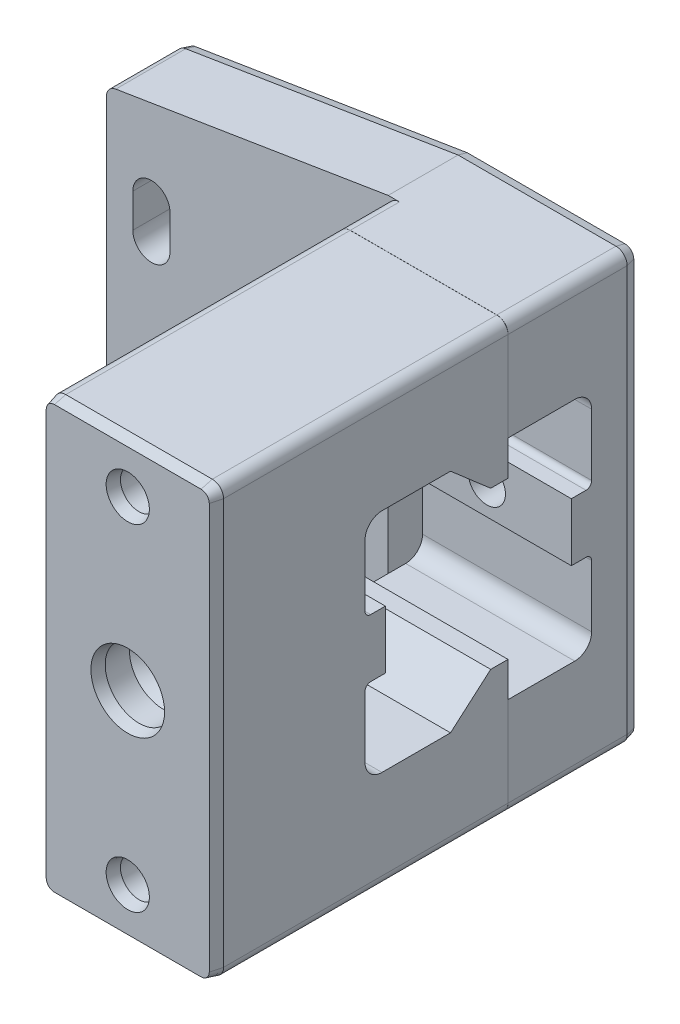
from build123d import *
from OCP.BRepFilletAPI import BRepFilletAPI_MakeChamfer

# Parameters (mm, degrees)
SKETCH1_R       = 1.65
SKETCH1_W       = 25
SKETCH1_H       = 29.9
EXTRUDE1_DEPTH  = 4
EXTRUDE2_DEPTH  = 4
FILLET1_R       = 1
SKETCH_R        = 1.65
EXTRUDE3_DEPTH  = 37.6
EXTRUDE4_REACH  = 51.146
EXTRUDE5_REACH  = 49.347
SKETCH4_R       = 1.65
FILLET2_R       = 1
EXTRUDE6_START  = -15
SKETCH5_W       = 0.01
SKETCH5_H       = 44.520085812
EXTRUDE6_DEPTH  = 15
EXTRUDE7_DEPTH  = 15
SKETCH7_W       = 15
SKETCH7_H       = 5.15
SKETCH7_R       = 1.65
EXTRUDE8_DEPTH  = 1.8
SKETCH_2_R      = 1.65
EXTRUDE9_DEPTH  = 48.347330088
SKETCH8_W       = 15
SKETCH8_H       = 5.15
SKETCH8_R       = 1.65
EXTRUDE10_DEPTH = 1.8
SKETCH11_R      = 3
EXTRUDE15_DEPTH = 3
CHAMFER1_SIZE   = 1.5
FILLET7_R       = 0.5
FILLET8_R       = 0.5
CHAMFER4_SIZE   = 1
CHAMFER4_SIZE2  = 0.267949192
EXTRUDE14_DEPTH = 10.5
CHAMFER5_SIZE   = 0.8
CHAMFER5_SIZE2  = 0.214359354
CHAMFER6_SIZE   = 0.8
CHAMFER6_SIZE2  = 0.214359354
EXTRUDE16_DEPTH = 5
CHAMFER7_SIZE   = 0.8
CHAMFER7_SIZE2  = 0.214359354
EXTRUDE17_DEPTH = 3


# Read off the part's stored shape, not the designer's step: Extrude17
with BuildPart() as part:
    # Sketch1 → Extrude1 (new body)
    # profile 1 of 2: a face of its own
    with BuildSketch(Plane.XY):
        Polygon((6.246843528, 15.35570294), (6.246843528, -14.54429706), (6.246843528, -18.59429706), (21.246843528, -18.59429706), (21.246843528, 19.40570294), (6.246843528, 19.40570294), align=None)
        with Locations((13.746843528, -14.49429706)):
            Circle(SKETCH1_R, mode=Mode.SUBTRACT)
        with Locations((13.746843528, 15.30570294)):
            Circle(SKETCH1_R, mode=Mode.SUBTRACT)
    # profile 2 of 2: a face of its own
    with BuildSketch(Plane.XY):
        with Locations((-6.253156472, 0.40570294)):
            Rectangle(SKETCH1_W, SKETCH1_H)
        with BuildLine():
            ThreePointArc((-13.103156472, -7.59429706), (-14.753156472, -9.24429706), (-16.403156472, -7.59429706))
            Line((-16.403156472, -7.59429706), (-16.403156472, -4.59429706))
            ThreePointArc((-16.403156472, -4.59429706), (-14.753156472, -2.94429706), (-13.103156472, -4.59429706))
            Line((-13.103156472, -4.59429706), (-13.103156472, -7.59429706))
        make_face(mode=Mode.SUBTRACT)
        with BuildLine():
            ThreePointArc((1.896843528, -7.59429706), (0.246843528, -9.24429706), (-1.403156472, -7.59429706))
            Line((-1.403156472, -7.59429706), (-1.403156472, -4.59429706))
            ThreePointArc((-1.403156472, -4.59429706), (0.246843528, -2.94429706), (1.896843528, -4.59429706))
            Line((1.896843528, -4.59429706), (1.896843528, -7.59429706))
        make_face(mode=Mode.SUBTRACT)
        with BuildLine():
            ThreePointArc((-16.403156472, 8.40570294), (-14.753156472, 10.05570294), (-13.103156472, 8.40570294))
            Line((-13.103156472, 8.40570294), (-13.103156472, 5.40570294))
            ThreePointArc((-13.103156472, 5.40570294), (-14.753156472, 3.75570294), (-16.403156472, 5.40570294))
            Line((-16.403156472, 5.40570294), (-16.403156472, 8.40570294))
        make_face(mode=Mode.SUBTRACT)
        with BuildLine():
            ThreePointArc((-1.403156472, 8.40570294), (0.246843528, 10.05570294), (1.896843528, 8.40570294))
            Line((1.896843528, 8.40570294), (1.896843528, 5.40570294))
            ThreePointArc((1.896843528, 5.40570294), (0.246843528, 3.75570294), (-1.403156472, 5.40570294))
            Line((-1.403156472, 5.40570294), (-1.403156472, 8.40570294))
        make_face(mode=Mode.SUBTRACT)
    extrude(amount=EXTRUDE1_DEPTH)

    # Sketch2 → Extrude2 (add)
    with BuildSketch(Plane(origin=(0, 0, 0), x_dir=(-1, 0, 0), z_dir=(0, 0, -1))):
        Polygon((-6.246843528, 19.40570294), (18.753156472, 15.35570294), (-6.246843528, 15.35570294), align=None)
        Polygon((-6.246843528, -14.54429706), (-6.246843528, -18.59429706), (18.753156472, -14.54429706), align=None)
    extrude(amount=-EXTRUDE2_DEPTH)

    # Fillet1
    fillet1_edges = [part.edges().sort_by_distance(p)[0] for p in [
        (-18.753156472, -14.54429706, 2),
        (-18.753156472, 15.35570294, 2),
    ]]
    fillet(fillet1_edges, radius=FILLET1_R)

    # Sketch → Extrude3 (add)
    with BuildSketch(Plane.XY):
        Polygon((21.246843528, 19.40570294), (6.246843528, 19.40570294), (6.246843528, 15.35570294), (6.246843528, -14.54429706), (6.246843528, -18.59429706), (21.246843528, -18.59429706), align=None)
        with Locations((13.746843528, -14.49429706)):
            Circle(SKETCH_R, mode=Mode.SUBTRACT)
        with Locations((13.746843528, 15.30570294)):
            Circle(SKETCH_R, mode=Mode.SUBTRACT)
    extrude(amount=EXTRUDE3_DEPTH)

    # Sketch3 → Extrude4 (cut, up to next)
    with BuildSketch(Plane.ZY.offset(-6.246843528), mode=Mode.PRIVATE) as extrude4_sk1:
        with BuildLine():
            Line((22.55, -9.64429706), (5.45, -9.64429706))
            ThreePointArc((5.45, -9.64429706), (4.389339828, -9.204957232), (3.95, -8.14429706))
            Line((3.95, -8.14429706), (3.95, 8.95570294))
            ThreePointArc((3.95, 8.95570294), (4.389339828, 10.016363112), (5.45, 10.45570294))
            Line((5.45, 10.45570294), (22.55, 10.45570294))
            ThreePointArc((22.55, 10.45570294), (23.610660172, 10.016363112), (24.05, 8.95570294))
            Line((24.05, 8.95570294), (24.05, -8.14429706))
            ThreePointArc((24.05, -8.14429706), (23.610660172, -9.204957232), (22.55, -9.64429706))
        make_face()
    extrude4_tool1 = extrude(extrude4_sk1.sketch, amount=-EXTRUDE4_REACH, mode=Mode.PRIVATE) & part.part
    add(extrude4_tool1.solids().sort_by_distance((6.246844, 0.405703, 14))[0], mode=Mode.SUBTRACT)

    # Sketch4 → Extrude5 (cut, up to next)
    with BuildSketch(Plane(origin=(0, 0, 0), x_dir=(-1, 0, 0), z_dir=(0, 0, -1)), mode=Mode.PRIVATE) as extrude5_sk1:
        with Locations((-13.746843528, 0.40570294)):
            Circle(SKETCH4_R)
    extrude5_tool1 = extrude(extrude5_sk1.sketch, amount=-EXTRUDE5_REACH, mode=Mode.PRIVATE) & part.part
    add(extrude5_tool1.solids().sort_by_distance((13.746844, 0.405703, 0))[0], mode=Mode.SUBTRACT)

    # Fillet2
    fillet2_edges = [part.edges().sort_by_distance(p)[0] for p in [
        (6.246843528, 19.40570294, 20.8),
        (6.246843528, -18.59429706, 20.8),
        (21.246843528, 19.40570294, 18.8),
        (21.246843528, -18.59429706, 18.8),
    ]]
    fillet(fillet2_edges, radius=FILLET2_R)

    # Sketch5 → Extrude6 (cut)
    with BuildSketch(Plane(origin=(21.246843528, 0, 0), x_dir=(0, 0, -1), z_dir=(1, 0, 0)).offset(EXTRUDE6_START)):
        with Locations((-11.365, -0.632215512)):
            Rectangle(SKETCH5_W, SKETCH5_H)
    extrude(amount=EXTRUDE6_DEPTH, mode=Mode.SUBTRACT)


with BuildPart() as extrude6_piece_1:
    # of the separate pieces the step leaves, piece 1, a body of its own (extrude6_pieces)
    add(part.part.solids().sort_by_distance((7.246843528, -18.59429706, 11.37))[0])

    # Sketch6 → Extrude7 (add)
    with BuildSketch(Plane(origin=(21.246843528, 0, 0), x_dir=(0, 0, -1), z_dir=(1, 0, 0))):
        Polygon((-11.37, 10.45570294), (-11.37, 7.362293772), (-12.906590833, 7.362293772), (-16.47, 10.45570294), align=None)
        Polygon((-16.47, -9.64429706), (-11.37, -9.64429706), (-11.37, -6.550887893), (-12.906590833, -6.550887893), align=None)
    extrude(amount=-EXTRUDE7_DEPTH)

    # Sketch 2 → Extrude9 (cut, through all)
    with BuildSketch(Plane(origin=(0, 0, 0), x_dir=(-1, 0, 0), z_dir=(0, 0, -1))):
        with Locations((-13.746843528, 0.40570294)):
            Circle(SKETCH_2_R)
    extrude(amount=-EXTRUDE9_DEPTH, mode=Mode.SUBTRACT)

    # Sketch8 → Extrude10 (add)
    with BuildSketch(Plane(origin=(0, 0, 24.05), x_dir=(-1, 0, 0), z_dir=(0, 0, -1))):
        with Locations((-13.746843528, 0.40570294)):
            Rectangle(SKETCH8_W, SKETCH8_H)
        with Locations((-13.746843528, 0.40570294)):
            Circle(SKETCH8_R, mode=Mode.SUBTRACT)
    extrude(amount=EXTRUDE10_DEPTH)

    # Sketch11 → Extrude15 (cut)
    with BuildSketch(Plane.XY.offset(37.6)):
        with Locations((13.746843528, 0.40570294)):
            Circle(SKETCH11_R)
    extrude(amount=-EXTRUDE15_DEPTH, mode=Mode.SUBTRACT)

    # Chamfer1
    # the kernel refuses this chamfer: 1.5 mm, written as the material it takes off along each edge
    with BuildSketch(Plane(origin=(13.746843528, 0.40570294, 34.6), x_dir=(-1, 0, 0), z_dir=(0, -1, 0))) as chamfer1_piece_1_section:
        Polygon((1.65 + CHAMFER1_SIZE, 0), (1.65, CHAMFER1_SIZE), (1.65, 0), align=None)
    chamfer1_piece_1 = revolve(axis=Axis((13.746843528, 0.40570294, 34.6), (0, 0, -1)), mode=Mode.PRIVATE)
    chamfer1_piece_1 = chamfer1_piece_1 & Plane(origin=(13.746843528, 0.40570294, 33.771694066), x_dir=(1, 0, 0), z_dir=(0, 0, 1)) * Cylinder(3, 13, mode=Mode.PRIVATE)
    add(chamfer1_piece_1, mode=Mode.SUBTRACT)

    # Fillet7
    fillet7_edges = [extrude6_piece_1.edges().sort_by_distance(p)[0] for p in [
        (13.746843528, 2.98070294, 24.05),
        (13.746843528, -2.16929706, 24.05),
    ]]
    fillet(fillet7_edges, radius=FILLET7_R)

    # Chamfer4: one chamfer whose edges measure the first distance from different faces: ONE call of the kernel's chamfer builder (chamfer() names one face for all edges)
    chamfer4_edges_1 = [extrude6_piece_1.edges().sort_by_distance(p)[0] for p in [
        (12.096843528, 15.30570294, 37.6),
    ]]
    chamfer4_side_1 = [extrude6_piece_1.faces().sort_by_distance(p)[0] for p in [
        (12.096843528, 15.30570294, 24.485),
    ]]
    chamfer4_edges_2 = [extrude6_piece_1.edges().sort_by_distance(p)[0] for p in [
        (12.096843528, -14.49429706, 37.6),
    ]]
    chamfer4_side_2 = [extrude6_piece_1.faces().sort_by_distance(p)[0] for p in [
        (12.096843528, -14.49429706, 24.485),
    ]]
    chamfer4_edges_3 = [extrude6_piece_1.edges().sort_by_distance(p)[0] for p in [
        (13.746843528, -18.59429706, 37.6),
    ]]
    chamfer4_side_3 = [extrude6_piece_1.faces().sort_by_distance(p)[0] for p in [
        (13.746843528, -18.59429706, 24.485),
    ]]
    chamfer4_edges_4 = [extrude6_piece_1.edges().sort_by_distance(p)[0] for p in [
        (6.246843528, 0.40570294, 37.6),
    ]]
    chamfer4_side_4 = [extrude6_piece_1.faces().sort_by_distance(p)[0] for p in [
        (6.246843528, 0.40570294, 26.542021551),
    ]]
    chamfer4_edges_5 = [extrude6_piece_1.edges().sort_by_distance(p)[0] for p in [
        (13.746843528, 19.40570294, 37.6),
    ]]
    chamfer4_side_5 = [extrude6_piece_1.faces().sort_by_distance(p)[0] for p in [
        (13.746843528, 19.40570294, 24.485),
    ]]
    chamfer4_edges_6 = [extrude6_piece_1.edges().sort_by_distance(p)[0] for p in [
        (21.246843528, 0.40570294, 37.6),
    ]]
    chamfer4_side_6 = [extrude6_piece_1.faces().sort_by_distance(p)[0] for p in [
        (21.246843528, 0.40570294, 26.542021551),
    ]]
    chamfer4_edges_7 = [extrude6_piece_1.edges().sort_by_distance(p)[0] for p in [
        (20.953950309, 19.112809721, 37.6),
    ]]
    chamfer4_side_7 = [extrude6_piece_1.faces().sort_by_distance(p)[0] for p in [
        (20.953950309, 19.112809721, 24.485),
    ]]
    chamfer4_edges_8 = [extrude6_piece_1.edges().sort_by_distance(p)[0] for p in [
        (20.953950309, -18.301403841, 37.6),
    ]]
    chamfer4_side_8 = [extrude6_piece_1.faces().sort_by_distance(p)[0] for p in [
        (20.953950309, -18.301403841, 24.485),
    ]]
    chamfer4_edges_9 = [extrude6_piece_1.edges().sort_by_distance(p)[0] for p in [
        (6.539736747, 19.112809721, 37.6),
    ]]
    chamfer4_side_9 = [extrude6_piece_1.faces().sort_by_distance(p)[0] for p in [
        (6.539736747, 19.112809721, 24.485),
    ]]
    chamfer4_edges_10 = [extrude6_piece_1.edges().sort_by_distance(p)[0] for p in [
        (6.539736747, -18.301403841, 37.6),
    ]]
    chamfer4_side_10 = [extrude6_piece_1.faces().sort_by_distance(p)[0] for p in [
        (6.539736747, -18.301403841, 24.485),
    ]]
    chamfer4_edges_11 = [extrude6_piece_1.edges().sort_by_distance(p)[0] for p in [
        (10.746843528, 0.40570294, 37.6),
    ]]
    chamfer4_side_11 = [extrude6_piece_1.faces().sort_by_distance(p)[0] for p in [
        (10.746843528, 0.40570294, 36.025),
    ]]
    chamfer4 = BRepFilletAPI_MakeChamfer(extrude6_piece_1.part.solid().wrapped)
    for e in chamfer4_edges_1:
        chamfer4.Add(CHAMFER4_SIZE, CHAMFER4_SIZE2, e.wrapped, chamfer4_side_1[0].wrapped)  # the first distance lies on this face
    for e in chamfer4_edges_2:
        chamfer4.Add(CHAMFER4_SIZE, CHAMFER4_SIZE2, e.wrapped, chamfer4_side_2[0].wrapped)  # the first distance lies on this face
    for e in chamfer4_edges_3:
        chamfer4.Add(CHAMFER4_SIZE, CHAMFER4_SIZE2, e.wrapped, chamfer4_side_3[0].wrapped)  # the first distance lies on this face
    for e in chamfer4_edges_4:
        chamfer4.Add(CHAMFER4_SIZE, CHAMFER4_SIZE2, e.wrapped, chamfer4_side_4[0].wrapped)  # the first distance lies on this face
    for e in chamfer4_edges_5:
        chamfer4.Add(CHAMFER4_SIZE, CHAMFER4_SIZE2, e.wrapped, chamfer4_side_5[0].wrapped)  # the first distance lies on this face
    for e in chamfer4_edges_6:
        chamfer4.Add(CHAMFER4_SIZE, CHAMFER4_SIZE2, e.wrapped, chamfer4_side_6[0].wrapped)  # the first distance lies on this face
    for e in chamfer4_edges_7:
        chamfer4.Add(CHAMFER4_SIZE, CHAMFER4_SIZE2, e.wrapped, chamfer4_side_7[0].wrapped)  # the first distance lies on this face
    for e in chamfer4_edges_8:
        chamfer4.Add(CHAMFER4_SIZE, CHAMFER4_SIZE2, e.wrapped, chamfer4_side_8[0].wrapped)  # the first distance lies on this face
    for e in chamfer4_edges_9:
        chamfer4.Add(CHAMFER4_SIZE, CHAMFER4_SIZE2, e.wrapped, chamfer4_side_9[0].wrapped)  # the first distance lies on this face
    for e in chamfer4_edges_10:
        chamfer4.Add(CHAMFER4_SIZE, CHAMFER4_SIZE2, e.wrapped, chamfer4_side_10[0].wrapped)  # the first distance lies on this face
    for e in chamfer4_edges_11:
        chamfer4.Add(CHAMFER4_SIZE, CHAMFER4_SIZE2, e.wrapped, chamfer4_side_11[0].wrapped)  # the first distance lies on this face
    add(Compound.cast(chamfer4.Shape()), mode=Mode.REPLACE)

    # Sketch10 → Extrude14 (cut)
    with BuildSketch(Plane(origin=(0, 0, 11.37), x_dir=(-1, 0, 0), z_dir=(0, 0, -1))):
        Polygon((-10.917827209, 15.30570294), (-12.332335368, 17.75570294), (-15.161351687, 17.75570294), (-16.575859847, 15.30570294), (-15.161351687, 12.85570294), (-12.332335368, 12.85570294), align=None)
        Polygon((-10.917827209, -14.49429706), (-12.332335368, -12.04429706), (-15.161351687, -12.04429706), (-16.575859847, -14.49429706), (-15.161351687, -16.94429706), (-12.332335368, -16.94429706), align=None)
    extrude(amount=-EXTRUDE14_DEPTH, mode=Mode.SUBTRACT)

    # Chamfer5: one chamfer whose edges measure the first distance from different faces: ONE call of the kernel's chamfer builder (chamfer() names one face for all edges)
    chamfer5_edges_1 = [extrude6_piece_1.edges().sort_by_distance(p)[0] for p in [
        (11.625081289, 14.08070294, 11.37),
    ]]
    chamfer5_side_1 = [extrude6_piece_1.faces().sort_by_distance(p)[0] for p in [
        (11.625081289, 14.08070294, 16.62),
    ]]
    chamfer5_edges_2 = [extrude6_piece_1.edges().sort_by_distance(p)[0] for p in [
        (11.625081289, 16.53070294, 11.37),
    ]]
    chamfer5_side_2 = [extrude6_piece_1.faces().sort_by_distance(p)[0] for p in [
        (11.625081289, 16.53070294, 16.62),
    ]]
    chamfer5_edges_3 = [extrude6_piece_1.edges().sort_by_distance(p)[0] for p in [
        (13.746843528, 17.75570294, 11.37),
    ]]
    chamfer5_side_3 = [extrude6_piece_1.faces().sort_by_distance(p)[0] for p in [
        (13.746843528, 17.75570294, 16.62),
    ]]
    chamfer5_edges_4 = [extrude6_piece_1.edges().sort_by_distance(p)[0] for p in [
        (15.868605767, 16.53070294, 11.37),
    ]]
    chamfer5_side_4 = [extrude6_piece_1.faces().sort_by_distance(p)[0] for p in [
        (15.868605767, 16.53070294, 16.62),
    ]]
    chamfer5_edges_5 = [extrude6_piece_1.edges().sort_by_distance(p)[0] for p in [
        (15.868605767, 14.08070294, 11.37),
    ]]
    chamfer5_side_5 = [extrude6_piece_1.faces().sort_by_distance(p)[0] for p in [
        (15.868605767, 14.08070294, 16.62),
    ]]
    chamfer5_edges_6 = [extrude6_piece_1.edges().sort_by_distance(p)[0] for p in [
        (13.746843528, 12.85570294, 11.37),
    ]]
    chamfer5_side_6 = [extrude6_piece_1.faces().sort_by_distance(p)[0] for p in [
        (13.746843528, 12.85570294, 16.62),
    ]]
    chamfer5_edges_7 = [extrude6_piece_1.edges().sort_by_distance(p)[0] for p in [
        (11.625081289, -15.71929706, 11.37),
    ]]
    chamfer5_side_7 = [extrude6_piece_1.faces().sort_by_distance(p)[0] for p in [
        (11.625081289, -15.71929706, 16.62),
    ]]
    chamfer5_edges_8 = [extrude6_piece_1.edges().sort_by_distance(p)[0] for p in [
        (11.625081289, -13.26929706, 11.37),
    ]]
    chamfer5_side_8 = [extrude6_piece_1.faces().sort_by_distance(p)[0] for p in [
        (11.625081289, -13.26929706, 16.62),
    ]]
    chamfer5_edges_9 = [extrude6_piece_1.edges().sort_by_distance(p)[0] for p in [
        (13.746843528, -12.04429706, 11.37),
    ]]
    chamfer5_side_9 = [extrude6_piece_1.faces().sort_by_distance(p)[0] for p in [
        (13.746843528, -12.04429706, 16.62),
    ]]
    chamfer5_edges_10 = [extrude6_piece_1.edges().sort_by_distance(p)[0] for p in [
        (15.868605767, -13.26929706, 11.37),
    ]]
    chamfer5_side_10 = [extrude6_piece_1.faces().sort_by_distance(p)[0] for p in [
        (15.868605767, -13.26929706, 16.62),
    ]]
    chamfer5_edges_11 = [extrude6_piece_1.edges().sort_by_distance(p)[0] for p in [
        (15.868605767, -15.71929706, 11.37),
    ]]
    chamfer5_side_11 = [extrude6_piece_1.faces().sort_by_distance(p)[0] for p in [
        (15.868605767, -15.71929706, 16.62),
    ]]
    chamfer5_edges_12 = [extrude6_piece_1.edges().sort_by_distance(p)[0] for p in [
        (13.746843528, -16.94429706, 11.37),
    ]]
    chamfer5_side_12 = [extrude6_piece_1.faces().sort_by_distance(p)[0] for p in [
        (13.746843528, -16.94429706, 16.62),
    ]]
    chamfer5 = BRepFilletAPI_MakeChamfer(extrude6_piece_1.part.solid().wrapped)
    for e in chamfer5_edges_1:
        chamfer5.Add(CHAMFER5_SIZE, CHAMFER5_SIZE2, e.wrapped, chamfer5_side_1[0].wrapped)  # the first distance lies on this face
    for e in chamfer5_edges_2:
        chamfer5.Add(CHAMFER5_SIZE, CHAMFER5_SIZE2, e.wrapped, chamfer5_side_2[0].wrapped)  # the first distance lies on this face
    for e in chamfer5_edges_3:
        chamfer5.Add(CHAMFER5_SIZE, CHAMFER5_SIZE2, e.wrapped, chamfer5_side_3[0].wrapped)  # the first distance lies on this face
    for e in chamfer5_edges_4:
        chamfer5.Add(CHAMFER5_SIZE, CHAMFER5_SIZE2, e.wrapped, chamfer5_side_4[0].wrapped)  # the first distance lies on this face
    for e in chamfer5_edges_5:
        chamfer5.Add(CHAMFER5_SIZE, CHAMFER5_SIZE2, e.wrapped, chamfer5_side_5[0].wrapped)  # the first distance lies on this face
    for e in chamfer5_edges_6:
        chamfer5.Add(CHAMFER5_SIZE, CHAMFER5_SIZE2, e.wrapped, chamfer5_side_6[0].wrapped)  # the first distance lies on this face
    for e in chamfer5_edges_7:
        chamfer5.Add(CHAMFER5_SIZE, CHAMFER5_SIZE2, e.wrapped, chamfer5_side_7[0].wrapped)  # the first distance lies on this face
    for e in chamfer5_edges_8:
        chamfer5.Add(CHAMFER5_SIZE, CHAMFER5_SIZE2, e.wrapped, chamfer5_side_8[0].wrapped)  # the first distance lies on this face
    for e in chamfer5_edges_9:
        chamfer5.Add(CHAMFER5_SIZE, CHAMFER5_SIZE2, e.wrapped, chamfer5_side_9[0].wrapped)  # the first distance lies on this face
    for e in chamfer5_edges_10:
        chamfer5.Add(CHAMFER5_SIZE, CHAMFER5_SIZE2, e.wrapped, chamfer5_side_10[0].wrapped)  # the first distance lies on this face
    for e in chamfer5_edges_11:
        chamfer5.Add(CHAMFER5_SIZE, CHAMFER5_SIZE2, e.wrapped, chamfer5_side_11[0].wrapped)  # the first distance lies on this face
    for e in chamfer5_edges_12:
        chamfer5.Add(CHAMFER5_SIZE, CHAMFER5_SIZE2, e.wrapped, chamfer5_side_12[0].wrapped)  # the first distance lies on this face
    add(Compound.cast(chamfer5.Shape()), mode=Mode.REPLACE)


with BuildPart() as extrude6_piece_2:
    # of the separate pieces the step leaves, piece 2, a body of its own (extrude6_pieces)
    add(part.part.solids().sort_by_distance((20.246843528, -18.59429706, 0))[0])

    # Sketch7 → Extrude8 (add)
    with BuildSketch(Plane.XY.offset(3.95)):
        with Locations((13.746843528, 0.40570294)):
            Rectangle(SKETCH7_W, SKETCH7_H)
        with Locations(Location((13.746843528, 0.40570294, 0), (0, 0, 180))):
            Circle(SKETCH7_R, mode=Mode.SUBTRACT)
    extrude(amount=EXTRUDE8_DEPTH)

    # Fillet8
    # the kernel refuses this fillet: 0.5 mm, written as the material it adds along each edge
    with BuildSketch(Plane(origin=(6.246843528, -2.16929706, 3.95), x_dir=(0, -1, 0), z_dir=(1, 0, 0)), Plane(origin=(21.246843528, 2.98070294, 3.95), x_dir=(0, 1, 0), z_dir=(-1, 0, 0))) as fillet8_piece_1:
        with BuildLine():
            CenterArc((FILLET8_R, -FILLET8_R), FILLET8_R, 90, 90)
            Line((0, -FILLET8_R), (0, 0))
            Line((0, 0), (FILLET8_R, 0))
        make_face()
    extrude(amount=15)

    # Chamfer6: one chamfer whose edges measure the first distance from different faces: ONE call of the kernel's chamfer builder (chamfer() names one face for all edges)
    chamfer6_edges_1 = [extrude6_piece_2.edges().sort_by_distance(p)[0] for p in [
        (13.246843528, 19.40570294, 0),
    ]]
    chamfer6_side_1 = [extrude6_piece_2.faces().sort_by_distance(p)[0] for p in [
        (13.562244372, 19.40570294, 5.582953586),
    ]]
    chamfer6_edges_2 = [extrude6_piece_2.edges().sort_by_distance(p)[0] for p in [
        (15.396843528, 0.40570294, 0),
    ]]
    chamfer6_side_2 = [extrude6_piece_2.faces().sort_by_distance(p)[0] for p in [
        (15.396843528, 0.40570294, 2.875),
    ]]
    chamfer6_edges_3 = [extrude6_piece_2.edges().sort_by_distance(p)[0] for p in [
        (13.246843528, -18.59429706, 0),
    ]]
    chamfer6_side_3 = [extrude6_piece_2.faces().sort_by_distance(p)[0] for p in [
        (13.562244372, -18.59429706, 5.582953586),
    ]]
    chamfer6_edges_4 = [extrude6_piece_2.edges().sort_by_distance(p)[0] for p in [
        (-16.403156472, -6.09429706, 0),
    ]]
    chamfer6_side_4 = [extrude6_piece_2.faces().sort_by_distance(p)[0] for p in [
        (-16.403156472, -6.09429706, 2),
    ]]
    chamfer6_edges_5 = [extrude6_piece_2.edges().sort_by_distance(p)[0] for p in [
        (1.896843528, 6.90570294, 0),
    ]]
    chamfer6_side_5 = [extrude6_piece_2.faces().sort_by_distance(p)[0] for p in [
        (1.896843528, 6.90570294, 2),
    ]]
    chamfer6_edges_6 = [extrude6_piece_2.edges().sort_by_distance(p)[0] for p in [
        (-1.403156472, -6.09429706, 0),
    ]]
    chamfer6_side_6 = [extrude6_piece_2.faces().sort_by_distance(p)[0] for p in [
        (-1.403156472, -6.09429706, 2),
    ]]
    chamfer6_edges_7 = [extrude6_piece_2.edges().sort_by_distance(p)[0] for p in [
        (21.246843528, 0.40570294, 0),
    ]]
    chamfer6_side_7 = [extrude6_piece_2.faces().sort_by_distance(p)[0] for p in [
        (21.246843528, 0.40570294, 4.557899541),
    ]]
    chamfer6_edges_8 = [extrude6_piece_2.edges().sort_by_distance(p)[0] for p in [
        (-13.103156472, 6.90570294, 0),
    ]]
    chamfer6_side_8 = [extrude6_piece_2.faces().sort_by_distance(p)[0] for p in [
        (-13.103156472, 6.90570294, 2),
    ]]
    chamfer6_edges_9 = [extrude6_piece_2.edges().sort_by_distance(p)[0] for p in [
        (12.096843528, -14.49429706, 0),
    ]]
    chamfer6_side_9 = [extrude6_piece_2.faces().sort_by_distance(p)[0] for p in [
        (12.096843528, -14.49429706, 5.68),
    ]]
    chamfer6_edges_10 = [extrude6_piece_2.edges().sort_by_distance(p)[0] for p in [
        (12.096843528, 15.30570294, 0),
    ]]
    chamfer6_side_10 = [extrude6_piece_2.faces().sort_by_distance(p)[0] for p in [
        (12.096843528, 15.30570294, 5.68),
    ]]
    chamfer6_edges_11 = [extrude6_piece_2.edges().sort_by_distance(p)[0] for p in [
        (20.953950309, -18.301403841, 0),
    ]]
    chamfer6_side_11 = [extrude6_piece_2.faces().sort_by_distance(p)[0] for p in [
        (20.953950309, -18.301403841, 5.68),
    ]]
    chamfer6_edges_12 = [extrude6_piece_2.edges().sort_by_distance(p)[0] for p in [
        (-5.833114064, -16.63734393, 0),
    ]]
    chamfer6_side_12 = [extrude6_piece_2.faces().sort_by_distance(p)[0] for p in [
        (-5.833114064, -16.63734393, 2),
    ]]
    chamfer6_edges_13 = [extrude6_piece_2.edges().sort_by_distance(p)[0] for p in [
        (-18.51470594, -14.34136683, 0),
    ]]
    chamfer6_side_13 = [extrude6_piece_2.faces().sort_by_distance(p)[0] for p in [
        (-18.51470594, -14.34136683, 2),
    ]]
    chamfer6_edges_14 = [extrude6_piece_2.edges().sort_by_distance(p)[0] for p in [
        (-18.753156472, 0.40570294, 0),
    ]]
    chamfer6_side_14 = [extrude6_piece_2.faces().sort_by_distance(p)[0] for p in [
        (-18.753156472, 0.40570294, 2),
    ]]
    chamfer6_edges_15 = [extrude6_piece_2.edges().sort_by_distance(p)[0] for p in [
        (-18.51470594, 15.15277271, 0),
    ]]
    chamfer6_side_15 = [extrude6_piece_2.faces().sort_by_distance(p)[0] for p in [
        (-18.51470594, 15.15277271, 2),
    ]]
    chamfer6_edges_16 = [extrude6_piece_2.edges().sort_by_distance(p)[0] for p in [
        (-5.833114064, 17.44874981, 0),
    ]]
    chamfer6_side_16 = [extrude6_piece_2.faces().sort_by_distance(p)[0] for p in [
        (-5.833114064, 17.44874981, 2),
    ]]
    chamfer6_edges_17 = [extrude6_piece_2.edges().sort_by_distance(p)[0] for p in [
        (20.953950309, 19.112809721, 0),
    ]]
    chamfer6_side_17 = [extrude6_piece_2.faces().sort_by_distance(p)[0] for p in [
        (20.953950309, 19.112809721, 5.68),
    ]]
    chamfer6_edges_18 = [extrude6_piece_2.edges().sort_by_distance(p)[0] for p in [
        (-14.753156472, 3.75570294, 0),
    ]]
    chamfer6_side_18 = [extrude6_piece_2.faces().sort_by_distance(p)[0] for p in [
        (-14.753156472, 3.75570294, 2),
    ]]
    chamfer6_edges_19 = [extrude6_piece_2.edges().sort_by_distance(p)[0] for p in [
        (-14.753156472, 10.05570294, 0),
    ]]
    chamfer6_side_19 = [extrude6_piece_2.faces().sort_by_distance(p)[0] for p in [
        (-14.753156472, 10.05570294, 2),
    ]]
    chamfer6_edges_20 = [extrude6_piece_2.edges().sort_by_distance(p)[0] for p in [
        (-16.403156472, 6.90570294, 0),
    ]]
    chamfer6_side_20 = [extrude6_piece_2.faces().sort_by_distance(p)[0] for p in [
        (-16.403156472, 6.90570294, 2),
    ]]
    chamfer6_edges_21 = [extrude6_piece_2.edges().sort_by_distance(p)[0] for p in [
        (-14.753156472, -2.94429706, 0),
    ]]
    chamfer6_side_21 = [extrude6_piece_2.faces().sort_by_distance(p)[0] for p in [
        (-14.753156472, -2.94429706, 2),
    ]]
    chamfer6_edges_22 = [extrude6_piece_2.edges().sort_by_distance(p)[0] for p in [
        (-14.753156472, -9.24429706, 0),
    ]]
    chamfer6_side_22 = [extrude6_piece_2.faces().sort_by_distance(p)[0] for p in [
        (-14.753156472, -9.24429706, 2),
    ]]
    chamfer6_edges_23 = [extrude6_piece_2.edges().sort_by_distance(p)[0] for p in [
        (-13.103156472, -6.09429706, 0),
    ]]
    chamfer6_side_23 = [extrude6_piece_2.faces().sort_by_distance(p)[0] for p in [
        (-13.103156472, -6.09429706, 2),
    ]]
    chamfer6_edges_24 = [extrude6_piece_2.edges().sort_by_distance(p)[0] for p in [
        (0.246843528, 3.75570294, 0),
    ]]
    chamfer6_side_24 = [extrude6_piece_2.faces().sort_by_distance(p)[0] for p in [
        (0.246843528, 3.75570294, 2),
    ]]
    chamfer6_edges_25 = [extrude6_piece_2.edges().sort_by_distance(p)[0] for p in [
        (0.246843528, 10.05570294, 0),
    ]]
    chamfer6_side_25 = [extrude6_piece_2.faces().sort_by_distance(p)[0] for p in [
        (0.246843528, 10.05570294, 2),
    ]]
    chamfer6_edges_26 = [extrude6_piece_2.edges().sort_by_distance(p)[0] for p in [
        (-1.403156472, 6.90570294, 0),
    ]]
    chamfer6_side_26 = [extrude6_piece_2.faces().sort_by_distance(p)[0] for p in [
        (-1.403156472, 6.90570294, 2),
    ]]
    chamfer6_edges_27 = [extrude6_piece_2.edges().sort_by_distance(p)[0] for p in [
        (0.246843528, -2.94429706, 0),
    ]]
    chamfer6_side_27 = [extrude6_piece_2.faces().sort_by_distance(p)[0] for p in [
        (0.246843528, -2.94429706, 2),
    ]]
    chamfer6_edges_28 = [extrude6_piece_2.edges().sort_by_distance(p)[0] for p in [
        (0.246843528, -9.24429706, 0),
    ]]
    chamfer6_side_28 = [extrude6_piece_2.faces().sort_by_distance(p)[0] for p in [
        (0.246843528, -9.24429706, 2),
    ]]
    chamfer6_edges_29 = [extrude6_piece_2.edges().sort_by_distance(p)[0] for p in [
        (1.896843528, -6.09429706, 0),
    ]]
    chamfer6_side_29 = [extrude6_piece_2.faces().sort_by_distance(p)[0] for p in [
        (1.896843528, -6.09429706, 2),
    ]]
    chamfer6 = BRepFilletAPI_MakeChamfer(extrude6_piece_2.part.solid().wrapped)
    for e in chamfer6_edges_1:
        chamfer6.Add(CHAMFER6_SIZE, CHAMFER6_SIZE2, e.wrapped, chamfer6_side_1[0].wrapped)  # the first distance lies on this face
    for e in chamfer6_edges_2:
        chamfer6.Add(CHAMFER6_SIZE, CHAMFER6_SIZE2, e.wrapped, chamfer6_side_2[0].wrapped)  # the first distance lies on this face
    for e in chamfer6_edges_3:
        chamfer6.Add(CHAMFER6_SIZE, CHAMFER6_SIZE2, e.wrapped, chamfer6_side_3[0].wrapped)  # the first distance lies on this face
    for e in chamfer6_edges_4:
        chamfer6.Add(CHAMFER6_SIZE, CHAMFER6_SIZE2, e.wrapped, chamfer6_side_4[0].wrapped)  # the first distance lies on this face
    for e in chamfer6_edges_5:
        chamfer6.Add(CHAMFER6_SIZE, CHAMFER6_SIZE2, e.wrapped, chamfer6_side_5[0].wrapped)  # the first distance lies on this face
    for e in chamfer6_edges_6:
        chamfer6.Add(CHAMFER6_SIZE, CHAMFER6_SIZE2, e.wrapped, chamfer6_side_6[0].wrapped)  # the first distance lies on this face
    for e in chamfer6_edges_7:
        chamfer6.Add(CHAMFER6_SIZE, CHAMFER6_SIZE2, e.wrapped, chamfer6_side_7[0].wrapped)  # the first distance lies on this face
    for e in chamfer6_edges_8:
        chamfer6.Add(CHAMFER6_SIZE, CHAMFER6_SIZE2, e.wrapped, chamfer6_side_8[0].wrapped)  # the first distance lies on this face
    for e in chamfer6_edges_9:
        chamfer6.Add(CHAMFER6_SIZE, CHAMFER6_SIZE2, e.wrapped, chamfer6_side_9[0].wrapped)  # the first distance lies on this face
    for e in chamfer6_edges_10:
        chamfer6.Add(CHAMFER6_SIZE, CHAMFER6_SIZE2, e.wrapped, chamfer6_side_10[0].wrapped)  # the first distance lies on this face
    for e in chamfer6_edges_11:
        chamfer6.Add(CHAMFER6_SIZE, CHAMFER6_SIZE2, e.wrapped, chamfer6_side_11[0].wrapped)  # the first distance lies on this face
    for e in chamfer6_edges_12:
        chamfer6.Add(CHAMFER6_SIZE, CHAMFER6_SIZE2, e.wrapped, chamfer6_side_12[0].wrapped)  # the first distance lies on this face
    for e in chamfer6_edges_13:
        chamfer6.Add(CHAMFER6_SIZE, CHAMFER6_SIZE2, e.wrapped, chamfer6_side_13[0].wrapped)  # the first distance lies on this face
    for e in chamfer6_edges_14:
        chamfer6.Add(CHAMFER6_SIZE, CHAMFER6_SIZE2, e.wrapped, chamfer6_side_14[0].wrapped)  # the first distance lies on this face
    for e in chamfer6_edges_15:
        chamfer6.Add(CHAMFER6_SIZE, CHAMFER6_SIZE2, e.wrapped, chamfer6_side_15[0].wrapped)  # the first distance lies on this face
    for e in chamfer6_edges_16:
        chamfer6.Add(CHAMFER6_SIZE, CHAMFER6_SIZE2, e.wrapped, chamfer6_side_16[0].wrapped)  # the first distance lies on this face
    for e in chamfer6_edges_17:
        chamfer6.Add(CHAMFER6_SIZE, CHAMFER6_SIZE2, e.wrapped, chamfer6_side_17[0].wrapped)  # the first distance lies on this face
    for e in chamfer6_edges_18:
        chamfer6.Add(CHAMFER6_SIZE, CHAMFER6_SIZE2, e.wrapped, chamfer6_side_18[0].wrapped)  # the first distance lies on this face
    for e in chamfer6_edges_19:
        chamfer6.Add(CHAMFER6_SIZE, CHAMFER6_SIZE2, e.wrapped, chamfer6_side_19[0].wrapped)  # the first distance lies on this face
    for e in chamfer6_edges_20:
        chamfer6.Add(CHAMFER6_SIZE, CHAMFER6_SIZE2, e.wrapped, chamfer6_side_20[0].wrapped)  # the first distance lies on this face
    for e in chamfer6_edges_21:
        chamfer6.Add(CHAMFER6_SIZE, CHAMFER6_SIZE2, e.wrapped, chamfer6_side_21[0].wrapped)  # the first distance lies on this face
    for e in chamfer6_edges_22:
        chamfer6.Add(CHAMFER6_SIZE, CHAMFER6_SIZE2, e.wrapped, chamfer6_side_22[0].wrapped)  # the first distance lies on this face
    for e in chamfer6_edges_23:
        chamfer6.Add(CHAMFER6_SIZE, CHAMFER6_SIZE2, e.wrapped, chamfer6_side_23[0].wrapped)  # the first distance lies on this face
    for e in chamfer6_edges_24:
        chamfer6.Add(CHAMFER6_SIZE, CHAMFER6_SIZE2, e.wrapped, chamfer6_side_24[0].wrapped)  # the first distance lies on this face
    for e in chamfer6_edges_25:
        chamfer6.Add(CHAMFER6_SIZE, CHAMFER6_SIZE2, e.wrapped, chamfer6_side_25[0].wrapped)  # the first distance lies on this face
    for e in chamfer6_edges_26:
        chamfer6.Add(CHAMFER6_SIZE, CHAMFER6_SIZE2, e.wrapped, chamfer6_side_26[0].wrapped)  # the first distance lies on this face
    for e in chamfer6_edges_27:
        chamfer6.Add(CHAMFER6_SIZE, CHAMFER6_SIZE2, e.wrapped, chamfer6_side_27[0].wrapped)  # the first distance lies on this face
    for e in chamfer6_edges_28:
        chamfer6.Add(CHAMFER6_SIZE, CHAMFER6_SIZE2, e.wrapped, chamfer6_side_28[0].wrapped)  # the first distance lies on this face
    for e in chamfer6_edges_29:
        chamfer6.Add(CHAMFER6_SIZE, CHAMFER6_SIZE2, e.wrapped, chamfer6_side_29[0].wrapped)  # the first distance lies on this face
    add(Compound.cast(chamfer6.Shape()), mode=Mode.REPLACE)

    # Sketch12 → Extrude16 (cut)
    with BuildSketch(Plane.XY.offset(11.36)):
        Polygon((16.575859847, 15.30570294), (15.161351687, 17.75570294), (12.332335368, 17.75570294), (10.917827209, 15.30570294), (12.332335368, 12.85570294), (15.161351687, 12.85570294), align=None)
        Polygon((16.575859847, -14.49429706), (15.161351687, -12.04429706), (12.332335368, -12.04429706), (10.917827209, -14.49429706), (12.332335368, -16.94429706), (15.161351687, -16.94429706), align=None)
    extrude(amount=-EXTRUDE16_DEPTH, mode=Mode.SUBTRACT)

    # Chamfer7: one chamfer whose edges measure the first distance from different faces: ONE call of the kernel's chamfer builder (chamfer() names one face for all edges)
    chamfer7_edges_1 = [extrude6_piece_2.edges().sort_by_distance(p)[0] for p in [
        (15.868605767, 14.08070294, 11.36),
    ]]
    chamfer7_side_1 = [extrude6_piece_2.faces().sort_by_distance(p)[0] for p in [
        (15.868605767, 14.08070294, 8.86),
    ]]
    chamfer7_edges_2 = [extrude6_piece_2.edges().sort_by_distance(p)[0] for p in [
        (15.868605767, 16.53070294, 11.36),
    ]]
    chamfer7_side_2 = [extrude6_piece_2.faces().sort_by_distance(p)[0] for p in [
        (15.868605767, 16.53070294, 8.86),
    ]]
    chamfer7_edges_3 = [extrude6_piece_2.edges().sort_by_distance(p)[0] for p in [
        (13.746843528, 17.75570294, 11.36),
    ]]
    chamfer7_side_3 = [extrude6_piece_2.faces().sort_by_distance(p)[0] for p in [
        (13.746843528, 17.75570294, 8.86),
    ]]
    chamfer7_edges_4 = [extrude6_piece_2.edges().sort_by_distance(p)[0] for p in [
        (11.625081289, 16.53070294, 11.36),
    ]]
    chamfer7_side_4 = [extrude6_piece_2.faces().sort_by_distance(p)[0] for p in [
        (11.625081289, 16.53070294, 8.86),
    ]]
    chamfer7_edges_5 = [extrude6_piece_2.edges().sort_by_distance(p)[0] for p in [
        (11.625081289, 14.08070294, 11.36),
    ]]
    chamfer7_side_5 = [extrude6_piece_2.faces().sort_by_distance(p)[0] for p in [
        (11.625081289, 14.08070294, 8.86),
    ]]
    chamfer7_edges_6 = [extrude6_piece_2.edges().sort_by_distance(p)[0] for p in [
        (13.746843528, 12.85570294, 11.36),
    ]]
    chamfer7_side_6 = [extrude6_piece_2.faces().sort_by_distance(p)[0] for p in [
        (13.746843528, 12.85570294, 8.86),
    ]]
    chamfer7_edges_7 = [extrude6_piece_2.edges().sort_by_distance(p)[0] for p in [
        (15.868605767, -15.71929706, 11.36),
    ]]
    chamfer7_side_7 = [extrude6_piece_2.faces().sort_by_distance(p)[0] for p in [
        (15.868605767, -15.71929706, 8.86),
    ]]
    chamfer7_edges_8 = [extrude6_piece_2.edges().sort_by_distance(p)[0] for p in [
        (15.868605767, -13.26929706, 11.36),
    ]]
    chamfer7_side_8 = [extrude6_piece_2.faces().sort_by_distance(p)[0] for p in [
        (15.868605767, -13.26929706, 8.86),
    ]]
    chamfer7_edges_9 = [extrude6_piece_2.edges().sort_by_distance(p)[0] for p in [
        (13.746843528, -12.04429706, 11.36),
    ]]
    chamfer7_side_9 = [extrude6_piece_2.faces().sort_by_distance(p)[0] for p in [
        (13.746843528, -12.04429706, 8.86),
    ]]
    chamfer7_edges_10 = [extrude6_piece_2.edges().sort_by_distance(p)[0] for p in [
        (11.625081289, -13.26929706, 11.36),
    ]]
    chamfer7_side_10 = [extrude6_piece_2.faces().sort_by_distance(p)[0] for p in [
        (11.625081289, -13.26929706, 8.86),
    ]]
    chamfer7_edges_11 = [extrude6_piece_2.edges().sort_by_distance(p)[0] for p in [
        (11.625081289, -15.71929706, 11.36),
    ]]
    chamfer7_side_11 = [extrude6_piece_2.faces().sort_by_distance(p)[0] for p in [
        (11.625081289, -15.71929706, 8.86),
    ]]
    chamfer7_edges_12 = [extrude6_piece_2.edges().sort_by_distance(p)[0] for p in [
        (13.746843528, -16.94429706, 11.36),
    ]]
    chamfer7_side_12 = [extrude6_piece_2.faces().sort_by_distance(p)[0] for p in [
        (13.746843528, -16.94429706, 8.86),
    ]]
    chamfer7 = BRepFilletAPI_MakeChamfer(extrude6_piece_2.part.solid().wrapped)
    for e in chamfer7_edges_1:
        chamfer7.Add(CHAMFER7_SIZE, CHAMFER7_SIZE2, e.wrapped, chamfer7_side_1[0].wrapped)  # the first distance lies on this face
    for e in chamfer7_edges_2:
        chamfer7.Add(CHAMFER7_SIZE, CHAMFER7_SIZE2, e.wrapped, chamfer7_side_2[0].wrapped)  # the first distance lies on this face
    for e in chamfer7_edges_3:
        chamfer7.Add(CHAMFER7_SIZE, CHAMFER7_SIZE2, e.wrapped, chamfer7_side_3[0].wrapped)  # the first distance lies on this face
    for e in chamfer7_edges_4:
        chamfer7.Add(CHAMFER7_SIZE, CHAMFER7_SIZE2, e.wrapped, chamfer7_side_4[0].wrapped)  # the first distance lies on this face
    for e in chamfer7_edges_5:
        chamfer7.Add(CHAMFER7_SIZE, CHAMFER7_SIZE2, e.wrapped, chamfer7_side_5[0].wrapped)  # the first distance lies on this face
    for e in chamfer7_edges_6:
        chamfer7.Add(CHAMFER7_SIZE, CHAMFER7_SIZE2, e.wrapped, chamfer7_side_6[0].wrapped)  # the first distance lies on this face
    for e in chamfer7_edges_7:
        chamfer7.Add(CHAMFER7_SIZE, CHAMFER7_SIZE2, e.wrapped, chamfer7_side_7[0].wrapped)  # the first distance lies on this face
    for e in chamfer7_edges_8:
        chamfer7.Add(CHAMFER7_SIZE, CHAMFER7_SIZE2, e.wrapped, chamfer7_side_8[0].wrapped)  # the first distance lies on this face
    for e in chamfer7_edges_9:
        chamfer7.Add(CHAMFER7_SIZE, CHAMFER7_SIZE2, e.wrapped, chamfer7_side_9[0].wrapped)  # the first distance lies on this face
    for e in chamfer7_edges_10:
        chamfer7.Add(CHAMFER7_SIZE, CHAMFER7_SIZE2, e.wrapped, chamfer7_side_10[0].wrapped)  # the first distance lies on this face
    for e in chamfer7_edges_11:
        chamfer7.Add(CHAMFER7_SIZE, CHAMFER7_SIZE2, e.wrapped, chamfer7_side_11[0].wrapped)  # the first distance lies on this face
    for e in chamfer7_edges_12:
        chamfer7.Add(CHAMFER7_SIZE, CHAMFER7_SIZE2, e.wrapped, chamfer7_side_12[0].wrapped)  # the first distance lies on this face
    add(Compound.cast(chamfer7.Shape()), mode=Mode.REPLACE)

    # Extrude17 outline → Extrude17 (add)
    with BuildSketch(Plane.XY.offset(4)):
        with BuildLine():
            ThreePointArc((-17.913071655, 15.49179668), (-18.51470594, 15.15277271), (-18.753156472, 14.504665922))
            Line((-18.753156472, 14.504665922), (-18.753156472, -13.693260042))
            ThreePointArc((-18.753156472, -13.693260042), (-18.51470594, -14.34136683), (-17.913071655, -14.680390801))
            Line((-17.913071655, -14.680390801), (6.246843528, -18.59429706))
            Line((6.246843528, -18.59429706), (7.246843528, -18.59429706))
            ThreePointArc((7.246843528, -18.59429706), (6.539736747, -18.301403841), (6.246843528, -17.59429706))
            Line((6.246843528, -17.59429706), (6.246843528, 18.40570294))
            ThreePointArc((6.246843528, 18.40570294), (6.539736747, 19.112809721), (7.246843528, 19.40570294))
            Line((7.246843528, 19.40570294), (6.246843528, 19.40570294))
            Line((6.246843528, 19.40570294), (-17.913071655, 15.49179668))
        make_face()
        with BuildLine():
            Line((-16.403156472, -7.59429706), (-16.403156472, -4.59429706))
            ThreePointArc((-16.403156472, -4.59429706), (-14.753156472, -2.94429706), (-13.103156472, -4.59429706))
            Line((-13.103156472, -4.59429706), (-13.103156472, -7.59429706))
            ThreePointArc((-13.103156472, -7.59429706), (-14.753156472, -9.24429706), (-16.403156472, -7.59429706))
        make_face(mode=Mode.SUBTRACT)
        with BuildLine():
            Line((-1.403156472, -7.59429706), (-1.403156472, -4.59429706))
            ThreePointArc((-1.403156472, -4.59429706), (0.246843528, -2.94429706), (1.896843528, -4.59429706))
            Line((1.896843528, -4.59429706), (1.896843528, -7.59429706))
            ThreePointArc((1.896843528, -7.59429706), (0.246843528, -9.24429706), (-1.403156472, -7.59429706))
        make_face(mode=Mode.SUBTRACT)
        with BuildLine():
            Line((-13.103156472, 8.40570294), (-13.103156472, 5.40570294))
            ThreePointArc((-13.103156472, 5.40570294), (-14.753156472, 3.75570294), (-16.403156472, 5.40570294))
            Line((-16.403156472, 5.40570294), (-16.403156472, 8.40570294))
            ThreePointArc((-16.403156472, 8.40570294), (-14.753156472, 10.05570294), (-13.103156472, 8.40570294))
        make_face(mode=Mode.SUBTRACT)
        with BuildLine():
            Line((1.896843528, 8.40570294), (1.896843528, 5.40570294))
            ThreePointArc((1.896843528, 5.40570294), (0.246843528, 3.75570294), (-1.403156472, 5.40570294))
            Line((-1.403156472, 5.40570294), (-1.403156472, 8.40570294))
            ThreePointArc((-1.403156472, 8.40570294), (0.246843528, 10.05570294), (1.896843528, 8.40570294))
        make_face(mode=Mode.SUBTRACT)
    extrude(amount=EXTRUDE17_DEPTH)


solid = Compound([extrude6_piece_1.part, extrude6_piece_2.part])
